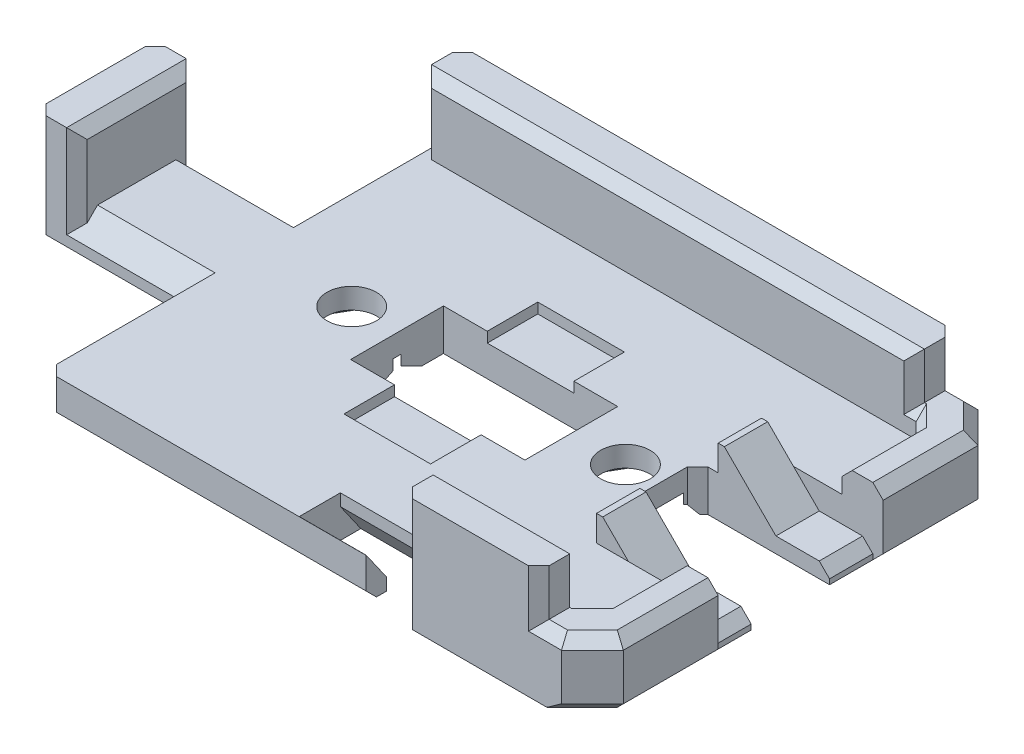
from build123d import *
from OCP.BRepFilletAPI import BRepFilletAPI_MakeChamfer

# Parameters (mm, degrees)
SKETCH1_R                      = 1.2
BOSS_EXTRUDE1_DEPTH            = 2
SKETCH2_W                      = 2
SKETCH2_H                      = 5.8
BOSS_EXTRUDE2_DEPTH            = 1.25
SKETCH3_W                      = 23.9
SKETCH3_H                      = 2
SKETCH3_W_2                    = 6.625
SKETCH3_W_3                    = 2
SKETCH3_H_2                    = 5.8
BOSS_EXTRUDE3_DEPTH            = 2.25
CUT_EXTRUDE1_REACH             = 30.156
CUT_EXTRUDE1_DIRECTION_2_REACH = 30.156
CUT_EXTRUDE2_DEPTH             = 1
SKETCH6_W                      = 1.75
SKETCH6_H                      = 1
CUT_EXTRUDE3_DEPTH             = 28.834331319
CHAMFER5_SIZE                  = 1.42
CHAMFER5_SIZE2                 = 0.994294704
CHAMFER2_SIZE                  = 1.5
CHAMFER4_SIZE                  = 1
CHAMFER1_SIZE                  = 0.5
CHAMFER3_SIZE                  = 0.5
SKETCH7_W                      = 4.2
SKETCH7_H                      = 9.4
CUT_EXTRUDE4_DEPTH             = 0.5


with BuildPart() as part:
    # Sketch1 → Boss-Extrude1 (new body)
    with BuildSketch(Plane(origin=(0, 0, 0), x_dir=(1, 0, 0), z_dir=(0, 1, 0))):
        Polygon((-25.7, 2.9), (-25.7, -2.9), (-18, -2.9), (-18, -10.1), (8.5, -10.1), (8.5, -4), (8, -4), (8, -1.9), (1.6, -1.9), (1.6, 1.9), (8, 1.9), (8, 4), (8.5, 4), (8.5, 10.1), (-18, 10.1), (-18, 2.9), align=None)
        with Locations(Location((-13.275, 0, 0), (0, 0, 270))):
            Circle(SKETCH1_R, mode=Mode.SUBTRACT)
        Polygon((-11.075, 2.25), (-6.85, 2.25), (-2.625, 2.25), (-2.625, -2.25), (-11.075, -2.25), align=None, mode=Mode.SUBTRACT)
        with Locations(Location((0, 0, 0), (0, 0, 270))):
            Circle(SKETCH1_R, mode=Mode.SUBTRACT)
    extrude(amount=BOSS_EXTRUDE1_DEPTH)

    # Sketch2 → Boss-Extrude2 (add)
    with BuildSketch(Plane(origin=(0, 2, 0), x_dir=(1, 0, 0), z_dir=(0, 1, 0))):
        Polygon((-18, 10.1), (8.5, 10.1), (8.5, 4), (8, 4), (8, 1.9), (2.6, 1.9), (2.6, 4), (6.5, 4), (6.5, 8.1), (-18, 8.1), align=None)
        Polygon((-0.725, -8.1), (-0.725, -10.1), (8.5, -10.1), (8.5, -4), (8, -4), (8, -1.9), (2.6, -1.9), (2.6, -4), (6.5, -4), (6.5, -8.1), align=None)
        with Locations((-24.7, 0)):
            Rectangle(SKETCH2_W, SKETCH2_H)
    extrude(amount=BOSS_EXTRUDE2_DEPTH)

    # Sketch3 → Boss-Extrude3 (add)
    with BuildSketch(Plane(origin=(0, 3.25, 0), x_dir=(1, 0, 0), z_dir=(0, 1, 0))):
        with Locations((-6.05, 9.1)):
            Rectangle(SKETCH3_W, SKETCH3_H)
        with Locations((2.5875, -9.1)):
            Rectangle(SKETCH3_W_2, SKETCH3_H)
        with Locations((-24.7, 0)):
            Rectangle(SKETCH3_W_3, SKETCH3_H_2)
    extrude(amount=BOSS_EXTRUDE3_DEPTH)

    # Cut-Extrude1: up to this face of the body (flat: up to its plane)
    cut_extrude1_end = Plane(part.part.faces().sort_by_distance((8.25, 1.625, -4))[0])
    # Sketch4 → Cut-Extrude1 (cut, up to the picked face)
    with BuildSketch(Plane.XY, mode=Mode.PRIVATE) as cut_extrude1_sk1:
        Polygon((8.5, 0.75), (5.4, 0.75), (-0.603500182, 6.753500182), (8.5, 6.753500182), align=None)
    cut_extrude1_tool1 = split(extrude(cut_extrude1_sk1.sketch, amount=-CUT_EXTRUDE1_REACH, mode=Mode.PRIVATE), bisect_by=cut_extrude1_end, keep=Keep.BOTH, mode=Mode.PRIVATE)
    add(cut_extrude1_tool1.solids().sort_by(Axis((5.203007, 4.243986, 0), (0, 0, -1)))[0], mode=Mode.SUBTRACT)

    # Cut-Extrude1 direction 2: up to this face of the body (flat: up to its plane)
    cut_extrude1_direction_2_end = Plane(part.part.faces().sort_by_distance((8.25, 1.625, 4))[0])
    # Sketch4 → Cut-Extrude1 direction 2 (cut, up to the picked face)
    with BuildSketch(Plane.XY, mode=Mode.PRIVATE) as cut_extrude1_direction_2_sk1:
        Polygon((8.5, 0.75), (5.4, 0.75), (-0.603500182, 6.753500182), (8.5, 6.753500182), align=None)
    cut_extrude1_direction_2_tool1 = split(extrude(cut_extrude1_direction_2_sk1.sketch, amount=CUT_EXTRUDE1_DIRECTION_2_REACH, mode=Mode.PRIVATE), bisect_by=cut_extrude1_direction_2_end, keep=Keep.BOTH, mode=Mode.PRIVATE)
    add(cut_extrude1_direction_2_tool1.solids().sort_by(Axis((5.203007, 4.243986, 0), (0, 0, 1)))[0], mode=Mode.SUBTRACT)

    # Sketch5 → Cut-Extrude2 (cut)
    with BuildSketch(Plane.XZ):
        Polygon((-15.584401077, 0), (-14.429700538, -2), (-12.120299462, -2), (-10.965598923, 0), (-12.120299462, 2), (-14.429700538, 2), align=None)
        Polygon((-2.309401077, 0), (-1.154700538, -2), (1.154700538, -2), (2.309401077, 0), (1.154700538, 2), (-1.154700538, 2), align=None)
    extrude(amount=-CUT_EXTRUDE2_DEPTH, mode=Mode.SUBTRACT)

    # Sketch6 → Cut-Extrude3 (cut, through all)
    with BuildSketch(Plane(origin=(0, 2, 0), x_dir=(1, 0, 0), z_dir=(0, 1, 0))):
        with Locations((-1.6, -9.6)):
            Rectangle(SKETCH6_W, SKETCH6_H)
        Polygon((-0.725, -9.1), (-0.725, -8.1), (-5.725, -8.1), (-5.725, -9.1), (-2.475, -9.1), align=None)
    extrude(amount=-CUT_EXTRUDE3_DEPTH, mode=Mode.SUBTRACT)

    # Chamfer5: one chamfer whose edges measure the first distance from different faces: ONE call of the kernel's chamfer builder (chamfer() names one face for all edges)
    chamfer5_edges_1 = [part.edges().sort_by_distance(p)[0] for p in [
        (-4.1, 2, 9.1),
    ]]
    chamfer5_side_1 = [part.faces().sort_by_distance(p)[0] for p in [
        (-4.1, 1, 9.1),
    ]]
    chamfer5_edges_2 = [part.edges().sort_by_distance(p)[0] for p in [
        (-3.225, 0, 8.1),
    ]]
    chamfer5_side_2 = [part.faces().sort_by_distance(p)[0] for p in [
        (-3.225, 1, 8.1),
    ]]
    chamfer5 = BRepFilletAPI_MakeChamfer(part.part.solid().wrapped)
    for e in chamfer5_edges_1:
        chamfer5.Add(CHAMFER5_SIZE, CHAMFER5_SIZE2, e.wrapped, chamfer5_side_1[0].wrapped)  # the first distance lies on this face
    for e in chamfer5_edges_2:
        chamfer5.Add(CHAMFER5_SIZE, CHAMFER5_SIZE2, e.wrapped, chamfer5_side_2[0].wrapped)  # the first distance lies on this face
    add(Compound.cast(chamfer5.Shape()), mode=Mode.REPLACE)

    # Chamfer2
    chamfer2_edges = [part.edges().sort_by_distance(p)[0] for p in [
        (8.5, 1.625, -10.1),
        (8.5, 1.625, 10.1),
    ]]
    chamfer(chamfer2_edges, length=CHAMFER2_SIZE)

    # Chamfer4
    chamfer4_edges = [part.edges().sort_by_distance(p)[0] for p in [
        (-20.85, 2, -2.9),
        (-20.85, 2, 2.9),
    ]]
    chamfer(chamfer4_edges, length=CHAMFER4_SIZE)

    # Chamfer1
    chamfer1_edges = [part.edges().sort_by_distance(p)[0] for p in [
        (6.5, 3.25, 6.05),
        (-23.7, 3.25, 2.9),
        (-23.7, 3.25, -2.9),
        (6.2, 3.25, -8.1),
        (5.9, 4.375, -10.1),
        (5.9, 4.375, -8.1),
        (-6.05, 5.5, -8.1),
        (6.45, 3.25, 10.1),
        (5.9, 4.375, 8.1),
        (5.9, 4.375, 10.1),
        (2.5875, 5.5, 8.1),
        (-23.7, 5.5, 0),
        (8, 0.75, 2.95),
        (8, 0.75, -2.95),
        (-5.5, 0, -10.1),
        (8.5, 0, -6.3),
        (-10.2375, 0, 10.1),
        (-18, 0, 6.5),
        (-21.85, 0, 2.9),
        (-25.7, 0, 0),
        (8.5, 0, 6.3),
        (8.5, 3.25, 6.3),
        (-21.85, 0, -2.9),
        (7.75, 0, -9.35),
        (7.75, 0, 9.35),
        (7.75, 3.25, 9.35),
        (6.45, 3.25, -10.1),
        (-18, 0, -6.5),
        (7.75, 3.25, -9.35),
        (-18, 2.75, -10.1),
        (1.6, 1, -1.9),
        (1.6, 1, 1.9),
        (-18, 1, 10.1),
        (-25.7, 2.75, 2.9),
        (-25.7, 2.75, -2.9),
        (-18, 3.75, -8.1),
        (6.5, 2.625, -8.1),
        (6.5, 3.25, -6.05),
        (8.5, 3.25, -6.3),
        (6.5, 2.625, 8.1),
        (-0.725, 3.75, 8.1),
        (-0.725, 2.75, 10.1),
        (6.2, 3.25, 8.1),
    ]]
    chamfer(chamfer1_edges, length=CHAMFER1_SIZE)

    # Chamfer3
    # the kernel refuses this chamfer: 0.5 mm, written as the material it takes off along each edge
    with BuildSketch(Plane(origin=(-12.763220209, 0, -3.113571399), x_dir=(0.8656979742248817, -0.027495876610586334, -0.4998109584556459), z_dir=(0.49999999999999756, 0, 0.8660254037844402))) as chamfer3_piece_1_section:
        Polygon((CHAMFER3_SIZE * 0.999621916911, CHAMFER3_SIZE * 0.0274958766106), (-CHAMFER3_SIZE * 0.0274958766106, CHAMFER3_SIZE * 0.999621916911), (0, 0), align=None)
    chamfer3_piece_1 = extrude(amount=4.662281911, mode=Mode.PRIVATE)
    chamfer3_piece_1 = split(chamfer3_piece_1, bisect_by=Plane(origin=(-11.112406069, 0.166390176, -2), z_dir=(0, 0, 1)), keep=Keep.TOP, mode=Mode.PRIVATE)
    add(chamfer3_piece_1, mode=Mode.SUBTRACT)
    with BuildSketch(Plane(origin=(-15.715542032, 0, -2), x_dir=(2.883353470067459e-15, -0.027495876610586365, -0.9996219169112968), z_dir=(1, 0, 0))) as chamfer3_piece_2_section:
        Polygon((CHAMFER3_SIZE * 0.999621916911, CHAMFER3_SIZE * 0.0274958766106), (-CHAMFER3_SIZE * 0.0274958766106, CHAMFER3_SIZE * 0.999621916911), (0, 0), align=None)
    chamfer3_piece_2 = extrude(amount=4.881084065, mode=Mode.PRIVATE)
    chamfer3_piece_2 = split(chamfer3_piece_2, bisect_by=Plane(origin=(-12.476630981, 0.169521721, -2.617184295), z_dir=(-0.86602540378444, 0, 0.4999999999999975)), keep=Keep.TOP, mode=Mode.PRIVATE)
    chamfer3_piece_2 = split(chamfer3_piece_2, bisect_by=Plane(origin=(-14.073369019, 0.169521721, -2.617184295), z_dir=(0.8660254037844374, 0, 0.5000000000000023)), keep=Keep.TOP, mode=Mode.PRIVATE)
    add(chamfer3_piece_2, mode=Mode.SUBTRACT)
    with BuildSketch(Plane(origin=(-16.227321824, 0, 1.113571399), x_dir=(-0.865697974224879, -0.027495876610586573, -0.4998109584556506), z_dir=(0.5000000000000023, 0, -0.8660254037844374))) as chamfer3_piece_3_section:
        Polygon((CHAMFER3_SIZE * 0.999621916911, CHAMFER3_SIZE * 0.0274958766106), (-CHAMFER3_SIZE * 0.0274958766106, CHAMFER3_SIZE * 0.999621916911), (0, 0), align=None)
    chamfer3_piece_3 = extrude(amount=4.881084065, mode=Mode.PRIVATE)
    chamfer3_piece_3 = split(chamfer3_piece_3, bisect_by=Plane(origin=(-15.142363577, 0.169521721, -2), z_dir=(0, 0, 1)), keep=Keep.TOP, mode=Mode.PRIVATE)
    chamfer3_piece_3 = split(chamfer3_piece_3, bisect_by=Plane(origin=(-15.940732596, 0.169521721, -0.617184295), z_dir=(0.86602540378444, 0, -0.4999999999999976)), keep=Keep.TOP, mode=Mode.PRIVATE)
    add(chamfer3_piece_3, mode=Mode.SUBTRACT)
    with BuildSketch(Plane(origin=(-13.786779791, 0, 3.113571399), x_dir=(-0.8656979742248816, -0.027495876610586382, 0.499810958455646), z_dir=(-0.4999999999999976, 0, -0.86602540378444))) as chamfer3_piece_4_section:
        Polygon((CHAMFER3_SIZE * 0.999621916911, CHAMFER3_SIZE * 0.0274958766106), (-CHAMFER3_SIZE * 0.0274958766106, CHAMFER3_SIZE * 0.999621916911), (0, 0), align=None)
    chamfer3_piece_4 = extrude(amount=4.881084065, mode=Mode.PRIVATE)
    chamfer3_piece_4 = split(chamfer3_piece_4, bisect_by=Plane(origin=(-15.940732596, 0.169521721, 0.617184295), z_dir=(0.8660254037844374, 0, 0.5000000000000023)), keep=Keep.TOP, mode=Mode.PRIVATE)
    chamfer3_piece_4 = split(chamfer3_piece_4, bisect_by=Plane(origin=(-15.142363577, 0.169521721, 2), z_dir=(0, 0, -1)), keep=Keep.TOP, mode=Mode.PRIVATE)
    add(chamfer3_piece_4, mode=Mode.SUBTRACT)
    with BuildSketch(Plane(origin=(-10.834457968, 0, 2), x_dir=(-2.7872416877318726e-15, -0.027495876610586365, 0.9996219169112968), z_dir=(-1, 0, 0))) as chamfer3_piece_5_section:
        Polygon((CHAMFER3_SIZE * 0.999621916911, CHAMFER3_SIZE * 0.0274958766106), (-CHAMFER3_SIZE * 0.0274958766106, CHAMFER3_SIZE * 0.999621916911), (0, 0), align=None)
    chamfer3_piece_5 = extrude(amount=4.881084065, mode=Mode.PRIVATE)
    chamfer3_piece_5 = split(chamfer3_piece_5, bisect_by=Plane(origin=(-14.073369019, 0.169521721, 2.617184295), z_dir=(0.86602540378444, 0, -0.4999999999999976)), keep=Keep.TOP, mode=Mode.PRIVATE)
    chamfer3_piece_5 = split(chamfer3_piece_5, bisect_by=Plane(origin=(-12.476630981, 0.169521721, 2.617184295), z_dir=(-0.8660254037844374, 0, -0.5000000000000023)), keep=Keep.TOP, mode=Mode.PRIVATE)
    add(chamfer3_piece_5, mode=Mode.SUBTRACT)
    with BuildSketch(Plane(origin=(-10.432079253, 0, -0.924083176), x_dir=(0.8656979742248789, -0.02749587661058633, 0.4998109584556506), z_dir=(-0.5000000000000023, 0, 0.8660254037844374))) as chamfer3_piece_6_section:
        Polygon((CHAMFER3_SIZE * 0.999621916911, CHAMFER3_SIZE * 0.0274958766106), (-CHAMFER3_SIZE * 0.0274958766106, CHAMFER3_SIZE * 0.999621916911), (0, 0), align=None)
    chamfer3_piece_6 = extrude(amount=4.662281911, mode=Mode.PRIVATE)
    chamfer3_piece_6 = split(chamfer3_piece_6, bisect_by=Plane(origin=(-11.112406069, 0.166390176, 2), z_dir=(0, 0, -1)), keep=Keep.TOP, mode=Mode.PRIVATE)
    add(chamfer3_piece_6, mode=Mode.SUBTRACT)
    with BuildSketch(Plane(origin=(0.511779791, 0, -3.113571399), x_dir=(0.86569797422488, -0.027495876610586348, -0.4998109584556486), z_dir=(0.5000000000000003, 0, 0.8660254037844386))) as chamfer3_piece_7_section:
        Polygon((CHAMFER3_SIZE * 0.999621916911, CHAMFER3_SIZE * 0.0274958766106), (-CHAMFER3_SIZE * 0.0274958766106, CHAMFER3_SIZE * 0.999621916911), (0, 0), align=None)
    chamfer3_piece_7 = extrude(amount=3.462281911, mode=Mode.PRIVATE)
    chamfer3_piece_7 = split(chamfer3_piece_7, bisect_by=Plane(origin=(1.860966622, 0.167251219, -2), z_dir=(0, 0, 1)), keep=Keep.TOP, mode=Mode.PRIVATE)
    add(chamfer3_piece_7, mode=Mode.SUBTRACT)
    with BuildSketch(Plane(origin=(-2.440542032, 0, -2), x_dir=(0, -0.027495876610586365, -0.9996219169112968), z_dir=(1, 0, 0))) as chamfer3_piece_8_section:
        Polygon((CHAMFER3_SIZE * 0.999621916911, CHAMFER3_SIZE * 0.0274958766106), (-CHAMFER3_SIZE * 0.0274958766106, CHAMFER3_SIZE * 0.999621916911), (0, 0), align=None)
    chamfer3_piece_8 = extrude(amount=4.881084065, mode=Mode.PRIVATE)
    chamfer3_piece_8 = split(chamfer3_piece_8, bisect_by=Plane(origin=(-0.798369019, 0.169521721, -2.617184295), z_dir=(0.8660254037844389, 0, 0.4999999999999995)), keep=Keep.TOP, mode=Mode.PRIVATE)
    chamfer3_piece_8 = split(chamfer3_piece_8, bisect_by=Plane(origin=(0.798369019, 0.169521721, -2.617184295), z_dir=(-0.8660254037844387, 0, 0.5000000000000003)), keep=Keep.TOP, mode=Mode.PRIVATE)
    add(chamfer3_piece_8, mode=Mode.SUBTRACT)
    with BuildSketch(Plane(origin=(-2.952321824, 0, 1.113571399), x_dir=(0.023812127644089732, 0.9996219169112968, 0.013747938305292919), z_dir=(0.4999999999999995, 0, -0.8660254037844389))) as chamfer3_piece_9_section:
        Polygon((CHAMFER3_SIZE * 0.999621916911, -CHAMFER3_SIZE * 0.0274958766106), (-CHAMFER3_SIZE * 0.0274958766106, -CHAMFER3_SIZE * 0.999621916911), (0, 0), align=None)
    chamfer3_piece_9 = extrude(amount=4.881084065, mode=Mode.PRIVATE)
    chamfer3_piece_9 = split(chamfer3_piece_9, bisect_by=Plane(origin=(-2.665732596, 0.169521721, -0.617184295), z_dir=(0.8660254037844386, 0, -0.5000000000000002)), keep=Keep.TOP, mode=Mode.PRIVATE)
    chamfer3_piece_9 = split(chamfer3_piece_9, bisect_by=Plane(origin=(-1.867363577, 0.169521721, -2), z_dir=(0, 0, 1)), keep=Keep.TOP, mode=Mode.PRIVATE)
    add(chamfer3_piece_9, mode=Mode.SUBTRACT)
    with BuildSketch(Plane(origin=(-0.511779791, 0, 3.113571399), x_dir=(-0.86569797422488, -0.027495876610586358, 0.4998109584556485), z_dir=(-0.5000000000000002, 0, -0.8660254037844386))) as chamfer3_piece_10_section:
        Polygon((CHAMFER3_SIZE * 0.999621916911, CHAMFER3_SIZE * 0.0274958766106), (-CHAMFER3_SIZE * 0.0274958766106, CHAMFER3_SIZE * 0.999621916911), (0, 0), align=None)
    chamfer3_piece_10 = extrude(amount=4.881084065, mode=Mode.PRIVATE)
    chamfer3_piece_10 = split(chamfer3_piece_10, bisect_by=Plane(origin=(-2.665732596, 0.169521721, 0.617184295), z_dir=(0.8660254037844389, 0, 0.4999999999999995)), keep=Keep.TOP, mode=Mode.PRIVATE)
    chamfer3_piece_10 = split(chamfer3_piece_10, bisect_by=Plane(origin=(-1.867363577, 0.169521721, 2), z_dir=(0, 0, -1)), keep=Keep.TOP, mode=Mode.PRIVATE)
    add(chamfer3_piece_10, mode=Mode.SUBTRACT)
    with BuildSketch(Plane(origin=(2.440542032, 0, 2), x_dir=(0, -0.027495876610586365, 0.9996219169112968), z_dir=(-1, 0, 0))) as chamfer3_piece_11_section:
        Polygon((CHAMFER3_SIZE * 0.999621916911, CHAMFER3_SIZE * 0.0274958766106), (-CHAMFER3_SIZE * 0.0274958766106, CHAMFER3_SIZE * 0.999621916911), (0, 0), align=None)
    chamfer3_piece_11 = extrude(amount=4.881084065, mode=Mode.PRIVATE)
    chamfer3_piece_11 = split(chamfer3_piece_11, bisect_by=Plane(origin=(0.798369019, 0.169521721, 2.617184295), z_dir=(-0.8660254037844387, 0, -0.5)), keep=Keep.TOP, mode=Mode.PRIVATE)
    chamfer3_piece_11 = split(chamfer3_piece_11, bisect_by=Plane(origin=(-0.798369019, 0.169521721, 2.617184295), z_dir=(0.8660254037844386, 0, -0.5000000000000002)), keep=Keep.TOP, mode=Mode.PRIVATE)
    add(chamfer3_piece_11, mode=Mode.SUBTRACT)
    with BuildSketch(Plane(origin=(2.242920747, 0, 0.115147309), x_dir=(0.8656979742248803, -0.027495876610586428, 0.49981095845564827), z_dir=(-0.5, 0, 0.8660254037844387))) as chamfer3_piece_12_section:
        Polygon((CHAMFER3_SIZE * 0.999621916911, CHAMFER3_SIZE * 0.0274958766106), (-CHAMFER3_SIZE * 0.0274958766106, CHAMFER3_SIZE * 0.999621916911), (0, 0), align=None)
    chamfer3_piece_12 = extrude(amount=3.462281911, mode=Mode.PRIVATE)
    chamfer3_piece_12 = split(chamfer3_piece_12, bisect_by=Plane(origin=(1.860966622, 0.167251219, 2), z_dir=(0, 0, -1)), keep=Keep.TOP, mode=Mode.PRIVATE)
    add(chamfer3_piece_12, mode=Mode.SUBTRACT)
    with BuildSketch(Plane(origin=(-15.715542032, 0, -2), x_dir=(2.883353470067459e-15, -0.027495876610586365, -0.9996219169112968), z_dir=(1, 0, 0))) as chamfer3_piece_13a_section:
        Polygon((CHAMFER3_SIZE * 0.999621916911, CHAMFER3_SIZE * 0.0274958766106), (-CHAMFER3_SIZE * 0.0274958766106, CHAMFER3_SIZE * 0.999621916911), (0, 0), align=None)
    chamfer3_piece_13a = extrude(amount=4.881084065, mode=Mode.PRIVATE)
    chamfer3_piece_13a = split(chamfer3_piece_13a, bisect_by=Plane(origin=(-12.046224912, 0.161348719, -1.871699116), z_dir=(0.86602540378444, 0, -0.4999999999999975)), keep=Keep.TOP, mode=Mode.PRIVATE)
    with BuildSketch(Plane(origin=(-12.763220209, 0, -3.113571399), x_dir=(0.8656979742248817, -0.027495876610586334, -0.4998109584556459), z_dir=(0.49999999999999756, 0, 0.8660254037844402))) as chamfer3_piece_13b_section:
        Polygon((CHAMFER3_SIZE * 0.999621916911, CHAMFER3_SIZE * 0.0274958766106), (-CHAMFER3_SIZE * 0.0274958766106, CHAMFER3_SIZE * 0.999621916911), (0, 0), align=None)
    chamfer3_piece_13b = extrude(amount=4.662281911, mode=Mode.PRIVATE)
    chamfer3_piece_13b = split(chamfer3_piece_13b, bisect_by=Plane(origin=(-12.268448562, 0.161348719, -2), z_dir=(0, 0, -1)), keep=Keep.TOP, mode=Mode.PRIVATE)
    chamfer3_piece_13 = chamfer3_piece_13a & chamfer3_piece_13b
    add(chamfer3_piece_13, mode=Mode.SUBTRACT)
    with BuildSketch(Plane(origin=(-16.227321824, 0, 1.113571399), x_dir=(-0.865697974224879, -0.027495876610586573, -0.4998109584556506), z_dir=(0.5000000000000023, 0, -0.8660254037844374))) as chamfer3_piece_14a_section:
        Polygon((CHAMFER3_SIZE * 0.999621916911, CHAMFER3_SIZE * 0.0274958766106), (-CHAMFER3_SIZE * 0.0274958766106, CHAMFER3_SIZE * 0.999621916911), (0, 0), align=None)
    chamfer3_piece_14a = extrude(amount=4.881084065, mode=Mode.PRIVATE)
    chamfer3_piece_14a = split(chamfer3_piece_14a, bisect_by=Plane(origin=(-14.281551438, 0.161348719, -2), z_dir=(0, 0, -1)), keep=Keep.TOP, mode=Mode.PRIVATE)
    with BuildSketch(Plane(origin=(-15.715542032, 0, -2), x_dir=(2.883353470067459e-15, -0.027495876610586365, -0.9996219169112968), z_dir=(1, 0, 0))) as chamfer3_piece_14b_section:
        Polygon((CHAMFER3_SIZE * 0.999621916911, CHAMFER3_SIZE * 0.0274958766106), (-CHAMFER3_SIZE * 0.0274958766106, CHAMFER3_SIZE * 0.999621916911), (0, 0), align=None)
    chamfer3_piece_14b = extrude(amount=4.881084065, mode=Mode.PRIVATE)
    chamfer3_piece_14b = split(chamfer3_piece_14b, bisect_by=Plane(origin=(-14.503775088, 0.161348719, -1.871699116), z_dir=(-0.8660254037844374, 0, -0.5000000000000023)), keep=Keep.TOP, mode=Mode.PRIVATE)
    chamfer3_piece_14 = chamfer3_piece_14a & chamfer3_piece_14b
    add(chamfer3_piece_14, mode=Mode.SUBTRACT)
    with BuildSketch(Plane(origin=(-13.786779791, 0, 3.113571399), x_dir=(-0.8656979742248816, -0.027495876610586382, 0.499810958455646), z_dir=(-0.4999999999999976, 0, -0.86602540378444))) as chamfer3_piece_15a_section:
        Polygon((CHAMFER3_SIZE * 0.999621916911, CHAMFER3_SIZE * 0.0274958766106), (-CHAMFER3_SIZE * 0.0274958766106, CHAMFER3_SIZE * 0.999621916911), (0, 0), align=None)
    chamfer3_piece_15a = extrude(amount=4.881084065, mode=Mode.PRIVATE)
    chamfer3_piece_15a = split(chamfer3_piece_15a, bisect_by=Plane(origin=(-15.510326527, 0.161348719, -0.128300884), z_dir=(-0.8660254037844374, 0, -0.5000000000000023)), keep=Keep.TOP, mode=Mode.PRIVATE)
    with BuildSketch(Plane(origin=(-16.227321824, 0, 1.113571399), x_dir=(-0.865697974224879, -0.027495876610586573, -0.4998109584556506), z_dir=(0.5000000000000023, 0, -0.8660254037844374))) as chamfer3_piece_15b_section:
        Polygon((CHAMFER3_SIZE * 0.999621916911, CHAMFER3_SIZE * 0.0274958766106), (-CHAMFER3_SIZE * 0.0274958766106, CHAMFER3_SIZE * 0.999621916911), (0, 0), align=None)
    chamfer3_piece_15b = extrude(amount=4.881084065, mode=Mode.PRIVATE)
    chamfer3_piece_15b = split(chamfer3_piece_15b, bisect_by=Plane(origin=(-15.510326527, 0.161348719, 0.128300884), z_dir=(-0.86602540378444, 0, 0.4999999999999976)), keep=Keep.TOP, mode=Mode.PRIVATE)
    chamfer3_piece_15 = chamfer3_piece_15a & chamfer3_piece_15b
    add(chamfer3_piece_15, mode=Mode.SUBTRACT)
    with BuildSketch(Plane(origin=(-10.834457968, 0, 2), x_dir=(-2.7872416877318726e-15, -0.027495876610586365, 0.9996219169112968), z_dir=(-1, 0, 0))) as chamfer3_piece_16a_section:
        Polygon((CHAMFER3_SIZE * 0.999621916911, CHAMFER3_SIZE * 0.0274958766106), (-CHAMFER3_SIZE * 0.0274958766106, CHAMFER3_SIZE * 0.999621916911), (0, 0), align=None)
    chamfer3_piece_16a = extrude(amount=4.881084065, mode=Mode.PRIVATE)
    chamfer3_piece_16a = split(chamfer3_piece_16a, bisect_by=Plane(origin=(-14.503775088, 0.161348719, 1.871699116), z_dir=(-0.86602540378444, 0, 0.4999999999999976)), keep=Keep.TOP, mode=Mode.PRIVATE)
    with BuildSketch(Plane(origin=(-13.786779791, 0, 3.113571399), x_dir=(-0.8656979742248816, -0.027495876610586382, 0.499810958455646), z_dir=(-0.4999999999999976, 0, -0.86602540378444))) as chamfer3_piece_16b_section:
        Polygon((CHAMFER3_SIZE * 0.999621916911, CHAMFER3_SIZE * 0.0274958766106), (-CHAMFER3_SIZE * 0.0274958766106, CHAMFER3_SIZE * 0.999621916911), (0, 0), align=None)
    chamfer3_piece_16b = extrude(amount=4.881084065, mode=Mode.PRIVATE)
    chamfer3_piece_16b = split(chamfer3_piece_16b, bisect_by=Plane(origin=(-14.281551438, 0.161348719, 2), z_dir=(0, 0, 1)), keep=Keep.TOP, mode=Mode.PRIVATE)
    chamfer3_piece_16 = chamfer3_piece_16a & chamfer3_piece_16b
    add(chamfer3_piece_16, mode=Mode.SUBTRACT)
    with BuildSketch(Plane(origin=(-10.432079253, 0, -0.924083176), x_dir=(0.8656979742248789, -0.02749587661058633, 0.4998109584556506), z_dir=(-0.5000000000000023, 0, 0.8660254037844374))) as chamfer3_piece_17a_section:
        Polygon((CHAMFER3_SIZE * 0.999621916911, CHAMFER3_SIZE * 0.0274958766106), (-CHAMFER3_SIZE * 0.0274958766106, CHAMFER3_SIZE * 0.999621916911), (0, 0), align=None)
    chamfer3_piece_17a = extrude(amount=4.662281911, mode=Mode.PRIVATE)
    chamfer3_piece_17a = split(chamfer3_piece_17a, bisect_by=Plane(origin=(-12.268448562, 0.161348719, 2), z_dir=(0, 0, 1)), keep=Keep.TOP, mode=Mode.PRIVATE)
    with BuildSketch(Plane(origin=(-10.834457968, 0, 2), x_dir=(-2.7872416877318726e-15, -0.027495876610586365, 0.9996219169112968), z_dir=(-1, 0, 0))) as chamfer3_piece_17b_section:
        Polygon((CHAMFER3_SIZE * 0.999621916911, CHAMFER3_SIZE * 0.0274958766106), (-CHAMFER3_SIZE * 0.0274958766106, CHAMFER3_SIZE * 0.999621916911), (0, 0), align=None)
    chamfer3_piece_17b = extrude(amount=4.881084065, mode=Mode.PRIVATE)
    chamfer3_piece_17b = split(chamfer3_piece_17b, bisect_by=Plane(origin=(-12.046224912, 0.161348719, 1.871699116), z_dir=(0.8660254037844374, 0, 0.5000000000000023)), keep=Keep.TOP, mode=Mode.PRIVATE)
    chamfer3_piece_17 = chamfer3_piece_17a & chamfer3_piece_17b
    add(chamfer3_piece_17, mode=Mode.SUBTRACT)
    with BuildSketch(Plane(origin=(-2.440542032, 0, -2), x_dir=(0, -0.027495876610586365, -0.9996219169112968), z_dir=(1, 0, 0))) as chamfer3_piece_18a_section:
        Polygon((CHAMFER3_SIZE * 0.999621916911, CHAMFER3_SIZE * 0.0274958766106), (-CHAMFER3_SIZE * 0.0274958766106, CHAMFER3_SIZE * 0.999621916911), (0, 0), align=None)
    chamfer3_piece_18a = extrude(amount=4.881084065, mode=Mode.PRIVATE)
    chamfer3_piece_18a = split(chamfer3_piece_18a, bisect_by=Plane(origin=(1.228775088, 0.161348719, -1.871699116), z_dir=(0.8660254037844387, 0, -0.5000000000000003)), keep=Keep.TOP, mode=Mode.PRIVATE)
    with BuildSketch(Plane(origin=(0.511779791, 0, -3.113571399), x_dir=(0.86569797422488, -0.027495876610586348, -0.4998109584556486), z_dir=(0.5000000000000003, 0, 0.8660254037844386))) as chamfer3_piece_18b_section:
        Polygon((CHAMFER3_SIZE * 0.999621916911, CHAMFER3_SIZE * 0.0274958766106), (-CHAMFER3_SIZE * 0.0274958766106, CHAMFER3_SIZE * 0.999621916911), (0, 0), align=None)
    chamfer3_piece_18b = extrude(amount=3.462281911, mode=Mode.PRIVATE)
    chamfer3_piece_18b = split(chamfer3_piece_18b, bisect_by=Plane(origin=(1.006551438, 0.161348719, -2), z_dir=(0, 0, -1)), keep=Keep.TOP, mode=Mode.PRIVATE)
    chamfer3_piece_18 = chamfer3_piece_18a & chamfer3_piece_18b
    add(chamfer3_piece_18, mode=Mode.SUBTRACT)
    with BuildSketch(Plane(origin=(-2.952321824, 0, 1.113571399), x_dir=(0.023812127644089732, 0.9996219169112968, 0.013747938305292919), z_dir=(0.4999999999999995, 0, -0.8660254037844389))) as chamfer3_piece_19a_section:
        Polygon((CHAMFER3_SIZE * 0.999621916911, -CHAMFER3_SIZE * 0.0274958766106), (-CHAMFER3_SIZE * 0.0274958766106, -CHAMFER3_SIZE * 0.999621916911), (0, 0), align=None)
    chamfer3_piece_19a = extrude(amount=4.881084065, mode=Mode.PRIVATE)
    chamfer3_piece_19a = split(chamfer3_piece_19a, bisect_by=Plane(origin=(-1.006551438, 0.161348719, -2), z_dir=(0, 0, -1)), keep=Keep.TOP, mode=Mode.PRIVATE)
    with BuildSketch(Plane(origin=(-2.440542032, 0, -2), x_dir=(0, -0.027495876610586365, -0.9996219169112968), z_dir=(1, 0, 0))) as chamfer3_piece_19b_section:
        Polygon((CHAMFER3_SIZE * 0.999621916911, CHAMFER3_SIZE * 0.0274958766106), (-CHAMFER3_SIZE * 0.0274958766106, CHAMFER3_SIZE * 0.999621916911), (0, 0), align=None)
    chamfer3_piece_19b = extrude(amount=4.881084065, mode=Mode.PRIVATE)
    chamfer3_piece_19b = split(chamfer3_piece_19b, bisect_by=Plane(origin=(-1.228775088, 0.161348719, -1.871699116), z_dir=(-0.8660254037844389, 0, -0.4999999999999995)), keep=Keep.TOP, mode=Mode.PRIVATE)
    chamfer3_piece_19 = chamfer3_piece_19a & chamfer3_piece_19b
    add(chamfer3_piece_19, mode=Mode.SUBTRACT)
    with BuildSketch(Plane(origin=(-2.952321824, 0, 1.113571399), x_dir=(0.023812127644089732, 0.9996219169112968, 0.013747938305292919), z_dir=(0.4999999999999995, 0, -0.8660254037844389))) as chamfer3_piece_20a_section:
        Polygon((CHAMFER3_SIZE * 0.999621916911, -CHAMFER3_SIZE * 0.0274958766106), (-CHAMFER3_SIZE * 0.0274958766106, -CHAMFER3_SIZE * 0.999621916911), (0, 0), align=None)
    chamfer3_piece_20a = extrude(amount=4.881084065, mode=Mode.PRIVATE)
    chamfer3_piece_20a = split(chamfer3_piece_20a, bisect_by=Plane(origin=(-2.235326527, 0.161348719, 0.128300884), z_dir=(-0.8660254037844386, 0, 0.5000000000000002)), keep=Keep.TOP, mode=Mode.PRIVATE)
    with BuildSketch(Plane(origin=(-0.511779791, 0, 3.113571399), x_dir=(-0.86569797422488, -0.027495876610586358, 0.4998109584556485), z_dir=(-0.5000000000000002, 0, -0.8660254037844386))) as chamfer3_piece_20b_section:
        Polygon((CHAMFER3_SIZE * 0.999621916911, CHAMFER3_SIZE * 0.0274958766106), (-CHAMFER3_SIZE * 0.0274958766106, CHAMFER3_SIZE * 0.999621916911), (0, 0), align=None)
    chamfer3_piece_20b = extrude(amount=4.881084065, mode=Mode.PRIVATE)
    chamfer3_piece_20b = split(chamfer3_piece_20b, bisect_by=Plane(origin=(-2.235326527, 0.161348719, -0.128300884), z_dir=(-0.8660254037844389, 0, -0.4999999999999995)), keep=Keep.TOP, mode=Mode.PRIVATE)
    chamfer3_piece_20 = chamfer3_piece_20a & chamfer3_piece_20b
    add(chamfer3_piece_20, mode=Mode.SUBTRACT)
    with BuildSketch(Plane(origin=(2.440542032, 0, 2), x_dir=(0, -0.027495876610586365, 0.9996219169112968), z_dir=(-1, 0, 0))) as chamfer3_piece_21a_section:
        Polygon((CHAMFER3_SIZE * 0.999621916911, CHAMFER3_SIZE * 0.0274958766106), (-CHAMFER3_SIZE * 0.0274958766106, CHAMFER3_SIZE * 0.999621916911), (0, 0), align=None)
    chamfer3_piece_21a = extrude(amount=4.881084065, mode=Mode.PRIVATE)
    chamfer3_piece_21a = split(chamfer3_piece_21a, bisect_by=Plane(origin=(-1.228775088, 0.161348719, 1.871699116), z_dir=(-0.8660254037844386, 0, 0.5000000000000002)), keep=Keep.TOP, mode=Mode.PRIVATE)
    with BuildSketch(Plane(origin=(-0.511779791, 0, 3.113571399), x_dir=(-0.86569797422488, -0.027495876610586358, 0.4998109584556485), z_dir=(-0.5000000000000002, 0, -0.8660254037844386))) as chamfer3_piece_21b_section:
        Polygon((CHAMFER3_SIZE * 0.999621916911, CHAMFER3_SIZE * 0.0274958766106), (-CHAMFER3_SIZE * 0.0274958766106, CHAMFER3_SIZE * 0.999621916911), (0, 0), align=None)
    chamfer3_piece_21b = extrude(amount=4.881084065, mode=Mode.PRIVATE)
    chamfer3_piece_21b = split(chamfer3_piece_21b, bisect_by=Plane(origin=(-1.006551438, 0.161348719, 2), z_dir=(0, 0, 1)), keep=Keep.TOP, mode=Mode.PRIVATE)
    chamfer3_piece_21 = chamfer3_piece_21a & chamfer3_piece_21b
    add(chamfer3_piece_21, mode=Mode.SUBTRACT)
    with BuildSketch(Plane(origin=(2.242920747, 0, 0.115147309), x_dir=(0.8656979742248803, -0.027495876610586428, 0.49981095845564827), z_dir=(-0.5, 0, 0.8660254037844387))) as chamfer3_piece_22a_section:
        Polygon((CHAMFER3_SIZE * 0.999621916911, CHAMFER3_SIZE * 0.0274958766106), (-CHAMFER3_SIZE * 0.0274958766106, CHAMFER3_SIZE * 0.999621916911), (0, 0), align=None)
    chamfer3_piece_22a = extrude(amount=3.462281911, mode=Mode.PRIVATE)
    chamfer3_piece_22a = split(chamfer3_piece_22a, bisect_by=Plane(origin=(1.006551438, 0.161348719, 2), z_dir=(0, 0, 1)), keep=Keep.TOP, mode=Mode.PRIVATE)
    with BuildSketch(Plane(origin=(2.440542032, 0, 2), x_dir=(0, -0.027495876610586365, 0.9996219169112968), z_dir=(-1, 0, 0))) as chamfer3_piece_22b_section:
        Polygon((CHAMFER3_SIZE * 0.999621916911, CHAMFER3_SIZE * 0.0274958766106), (-CHAMFER3_SIZE * 0.0274958766106, CHAMFER3_SIZE * 0.999621916911), (0, 0), align=None)
    chamfer3_piece_22b = extrude(amount=4.881084065, mode=Mode.PRIVATE)
    chamfer3_piece_22b = split(chamfer3_piece_22b, bisect_by=Plane(origin=(1.228775088, 0.161348719, 1.871699116), z_dir=(0.8660254037844387, 0, 0.5)), keep=Keep.TOP, mode=Mode.PRIVATE)
    chamfer3_piece_22 = chamfer3_piece_22a & chamfer3_piece_22b
    add(chamfer3_piece_22, mode=Mode.SUBTRACT)

    # Sketch7 → Cut-Extrude4 (cut)
    with BuildSketch(Plane(origin=(0, 2, 0), x_dir=(1, 0, 0), z_dir=(0, 1, 0))):
        with Locations((-6.85, 0)):
            Rectangle(SKETCH7_W, SKETCH7_H)
    extrude(amount=-CUT_EXTRUDE4_DEPTH, mode=Mode.SUBTRACT)


solid = part.part
